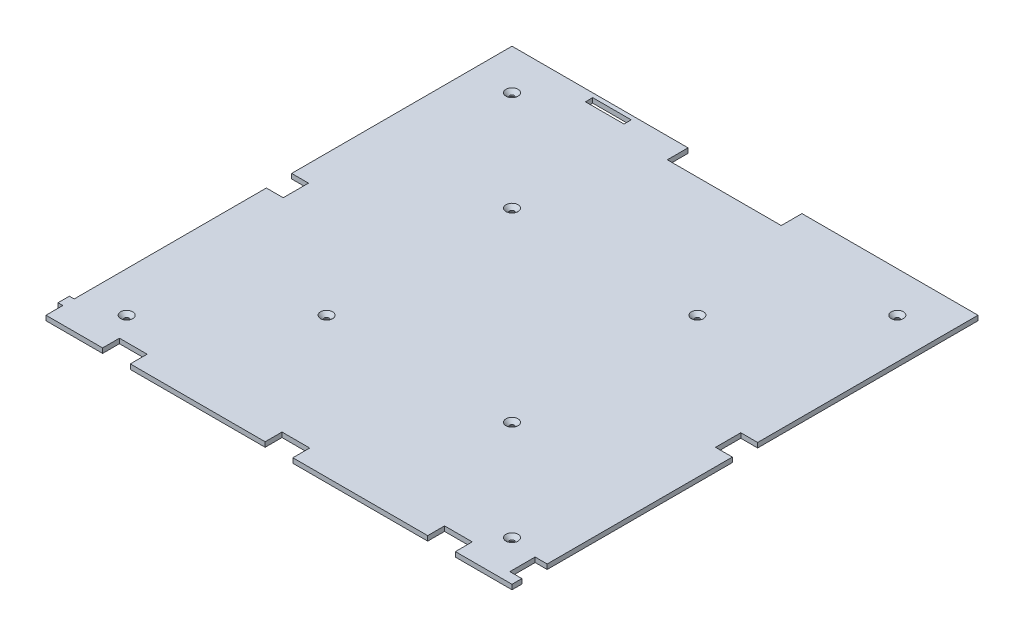
from build123d import *

# Parameters (mm, degrees)
BOSS_EXTRUDE1_DEPTH     = 2
CUT_EXTRUDE1_DEPTH      = 139.261075506
CUT_EXTRUDE1_DEPTH_BACK = 139.261075506
SKETCH2_R               = 1
CHAMFER1_SIZE           = 1.5
SKETCH3_W               = 10
SKETCH3_H               = 41
CUT_EXTRUDE2_DEPTH      = 1.4
SKETCH4_W               = 7
SKETCH4_H               = 10.5
CUT_EXTRUDE3_DEPTH      = 139.261075506
SKETCH5_W               = 16
SKETCH5_H               = 3
CUT_EXTRUDE4_DEPTH      = 139.261075506


with BuildPart() as part:
    # Sketch1 → Boss-Extrude1 (new body)
    with BuildSketch(Plane(origin=(0, 0, 0), x_dir=(1, 0, 0), z_dir=(0, 1, 0))):
        Polygon((5.75, -96.75), (61.746519787, -96.75), (61.746519787, -89.753578842), (73.246519787, -89.753578842), (73.246519787, -96.75), (96.75, -96.75), (96.75, -92.65), (91.75, -92.65), (91.75, -82.15), (96.75, -82.15), (96.75, 96.75), (23.65, 96.75), (23.65, 88.15), (-23.65, 88.15), (-23.65, 96.75), (-96.75, 96.75), (-96.75, -85.05), (-98.75, -85.05), (-98.75, -89.75), (-96.75, -89.75), (-96.75, -96.75), (-73.246519787, -96.75), (-73.246519787, -89.753578842), (-61.746519787, -89.753578842), (-61.746519787, -96.75), (-5.75, -96.75), (-5.75, -89.753578842), (5.75, -89.753578842), align=None)
    extrude(amount=BOSS_EXTRUDE1_DEPTH)

    # Sketch2 → Cut-Extrude1 (cut, two sides: drawn at the far end of the back side and taken through both)
    with BuildSketch(Plane.XZ.offset(-CUT_EXTRUDE1_DEPTH_BACK)):
        with Locations((80, 80)):
            Circle(SKETCH2_R)
        with Locations((-80, 80)):
            Circle(SKETCH2_R)
        with Locations((-38.5, 38.5)):
            Circle(SKETCH2_R)
        with Locations((38.5, 38.5)):
            Circle(SKETCH2_R)
        with Locations((80, -80)):
            Circle(SKETCH2_R)
        with Locations((-80, -80)):
            Circle(SKETCH2_R)
        with Locations((38.5, -38.5)):
            Circle(SKETCH2_R)
        with Locations((-38.5, -38.5)):
            Circle(SKETCH2_R)
    extrude(amount=CUT_EXTRUDE1_DEPTH + CUT_EXTRUDE1_DEPTH_BACK, mode=Mode.SUBTRACT)

    # Chamfer1
    chamfer1_edges = [part.edges().sort_by_distance(p)[0] for p in [
        (79, 2, 80),
        (-81, 2, 80),
        (37.5, 2, 38.5),
        (-39.5, 2, 38.5),
        (-39.5, 2, -38.5),
        (79, 2, -80),
        (37.5, 2, -38.5),
        (-81, 2, -80),
    ]]
    chamfer(chamfer1_edges, length=CHAMFER1_SIZE)

    # Sketch3 → Cut-Extrude2 (cut)
    with BuildSketch(Plane.XZ):
        with Locations((-38.75, -0.25)):
            Rectangle(SKETCH3_W, SKETCH3_H)
    extrude(amount=-CUT_EXTRUDE2_DEPTH, mode=Mode.SUBTRACT)

    # Sketch4 → Cut-Extrude3 (cut, through all)
    with BuildSketch(Plane(origin=(0, 2, 0), x_dir=(1, 0, 0), z_dir=(0, 1, 0))):
        with Locations((-93.25, 0)):
            Rectangle(SKETCH4_W, SKETCH4_H)
        with Locations((93.25, 0)):
            Rectangle(SKETCH4_W, SKETCH4_H)
    extrude(amount=-CUT_EXTRUDE3_DEPTH, mode=Mode.SUBTRACT)

    # Sketch5 → Cut-Extrude4 (cut, through all)
    with BuildSketch(Plane.XZ):
        with Locations((-53.5, -93.5)):
            Rectangle(SKETCH5_W, SKETCH5_H)
    extrude(amount=-CUT_EXTRUDE4_DEPTH, mode=Mode.SUBTRACT)


solid = part.part
